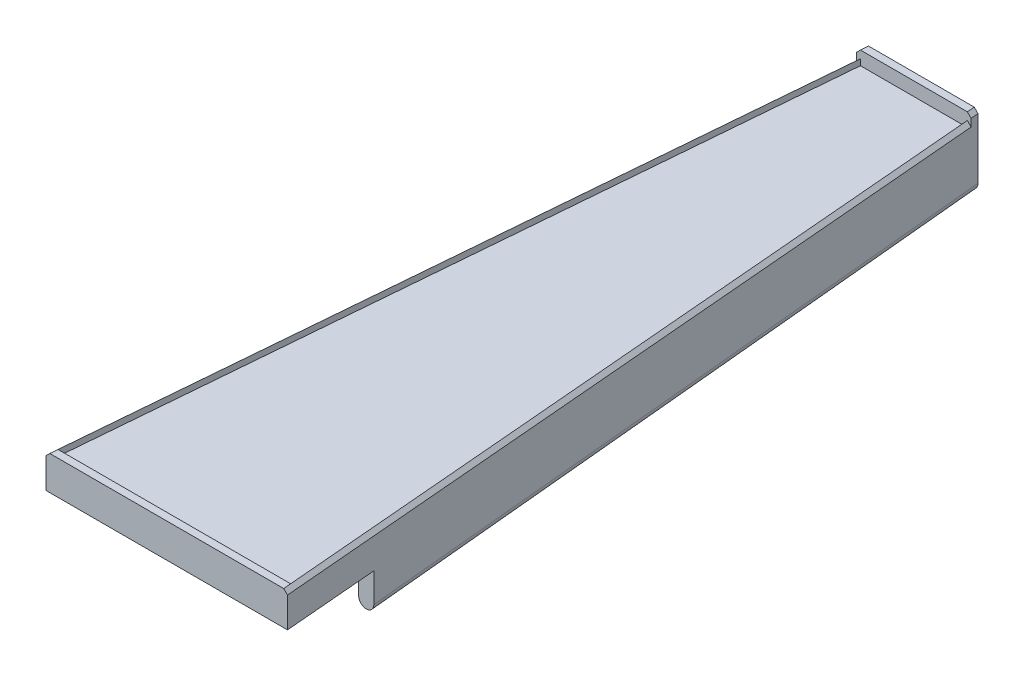
from build123d import *

# Parameters (mm, degrees)
BOSS_EXTRUDE1_DEPTH      = 19
CUT_EXTRUDE1_DEPTH       = 204.4330356653019
CUT_EXTRUDE1_DEPTH_BACK  = 204.4330356653019
SHELL1_T                 = -4
SHELL1_THICKNESS_2_DEPTH = 5
FILLET2_R                = 2
FILLET3_R                = 2
BOSS_EXTRUDE2_DEPTH      = 1.9999999999999862
CHAMFER1_SIZE            = 1
CHAMFER2_SIZE            = 1
CUT_EXTRUDE2_DEPTH       = 1.6
CUT_EXTRUDE3_DEPTH       = 25.000000000000007


with BuildPart() as part:
    # Sketch1 → Boss-Extrude1 (new body)
    with BuildSketch(Plane(origin=(0, 0, 0), x_dir=(1, 0, 0), z_dir=(0, 1, 0))):
        Polygon((15, 1.84e-15), (-15, -1.84e-15), (-31.99999999999997, -200), (32.00000000000003, -200), align=None)
    extrude(amount=BOSS_EXTRUDE1_DEPTH)

    # Sketch4 → Cut-Extrude1 (cut, two sides: drawn at the far end of the back side and taken through both)
    with BuildSketch(Plane(origin=(0, 0, 0), x_dir=(0, 0, -1), z_dir=(1, 0, 0)).offset(-CUT_EXTRUDE1_DEPTH_BACK)):
        Polygon((-200, 0), (0, 0), (1.59e-15, 2), align=None)
    extrude(amount=CUT_EXTRUDE1_DEPTH + CUT_EXTRUDE1_DEPTH_BACK, mode=Mode.SUBTRACT)

    # Shell1
    shell1_openings = [part.faces().sort_by_distance(p)[0] for p in [
        (0, 0.879432624, 112.056737589),
    ]]
    offset(amount=SHELL1_T, openings=shell1_openings, kind=Kind.INTERSECTION)

    # Shell1 thickness 2 face (on inner face of the shell) → Shell1 thickness 2 (add)
    with BuildSketch(Plane(origin=(0, 15, 113.400681607), x_dir=(0, 0, 1), z_dir=(0, 1, 0))):
        Polygon((-109.400681607, 11.325576006448747), (82.599318393, 27.645576006448778), (82.599318393, -27.645576006448714), (-109.400681607, -11.325576006448745), align=None)
    extrude(amount=-SHELL1_THICKNESS_2_DEPTH)

    # Fillet2
    fillet2_edges = [part.edges().sort_by_distance(p)[0] for p in [
        (23.500000000000014, 0.9999999999999999, 100.00000000000001),
        (19.485576006448763, 1.0000000000000002, 100),
    ]]
    fillet(fillet2_edges, radius=FILLET2_R - 0.0001)  # a hair under: the kernel refuses the full size

    # Fillet3
    fillet3_edges = [part.edges().sort_by_distance(p)[0] for p in [
        (-23.499999999999986, 1, 100),
        (-19.48557600644873, 0.9999999999999998, 100),
    ]]
    fillet(fillet3_edges, radius=FILLET3_R - 0.0001)  # a hair under: the kernel refuses the full size

    # Sketch5 → Boss-Extrude2 (add)
    with BuildSketch(Plane(origin=(0, 19, 0), x_dir=(1, 0, 0), z_dir=(0, 1, 0))):
        Polygon((-15, -1.84e-15), (-15.169255888521393, -1.9912457473105094), (15.169255888521398, -1.9912457473105094), (15, 1.84e-15), align=None)
    extrude(amount=BOSS_EXTRUDE2_DEPTH)

    # Chamfer1
    chamfer1_edges = [part.edges().sort_by_distance(p)[0] for p in [
        (23.58462794426071, 19, 100.99562287365525),
        (-23.58462794426068, 19, 100.99562287365526),
    ]]
    chamfer(chamfer1_edges, length=CHAMFER1_SIZE)

    # Chamfer2
    chamfer2_edges = [part.edges().sort_by_distance(p)[0] for p in [
        (-15.084627944260696, 20.999999999999986, 0.9956228736552557),
        (15.0846279442607, 20.999999999999986, 0.9956228736552538),
    ]]
    chamfer(chamfer2_edges, length=CHAMFER2_SIZE)

    # Sketch6 → Cut-Extrude2 (cut)
    with BuildSketch(Plane(origin=(0, 19, 0), x_dir=(1, 0, 0), z_dir=(0, 1, 0))):
        Polygon((-14.165649890133558, -1.9912457473105094), (14.16564989013358, -1.9912457473105079), (30.825649890133608, -197.99124574731053), (-30.825649890133526, -197.99124574731053), align=None)
    extrude(amount=-CUT_EXTRUDE2_DEPTH, mode=Mode.SUBTRACT)

    # Sketch7 → Cut-Extrude3 (cut)
    with BuildSketch(Plane.XY.offset(200)):
        Polygon((-31.99999999999997, 9.99920305283565), (32.00000000000003, 9.999203052835664), (32.00000000000003, 0), (-31.99999999999997, 0), align=None)
    extrude(amount=-CUT_EXTRUDE3_DEPTH, mode=Mode.SUBTRACT)


solid = part.part
